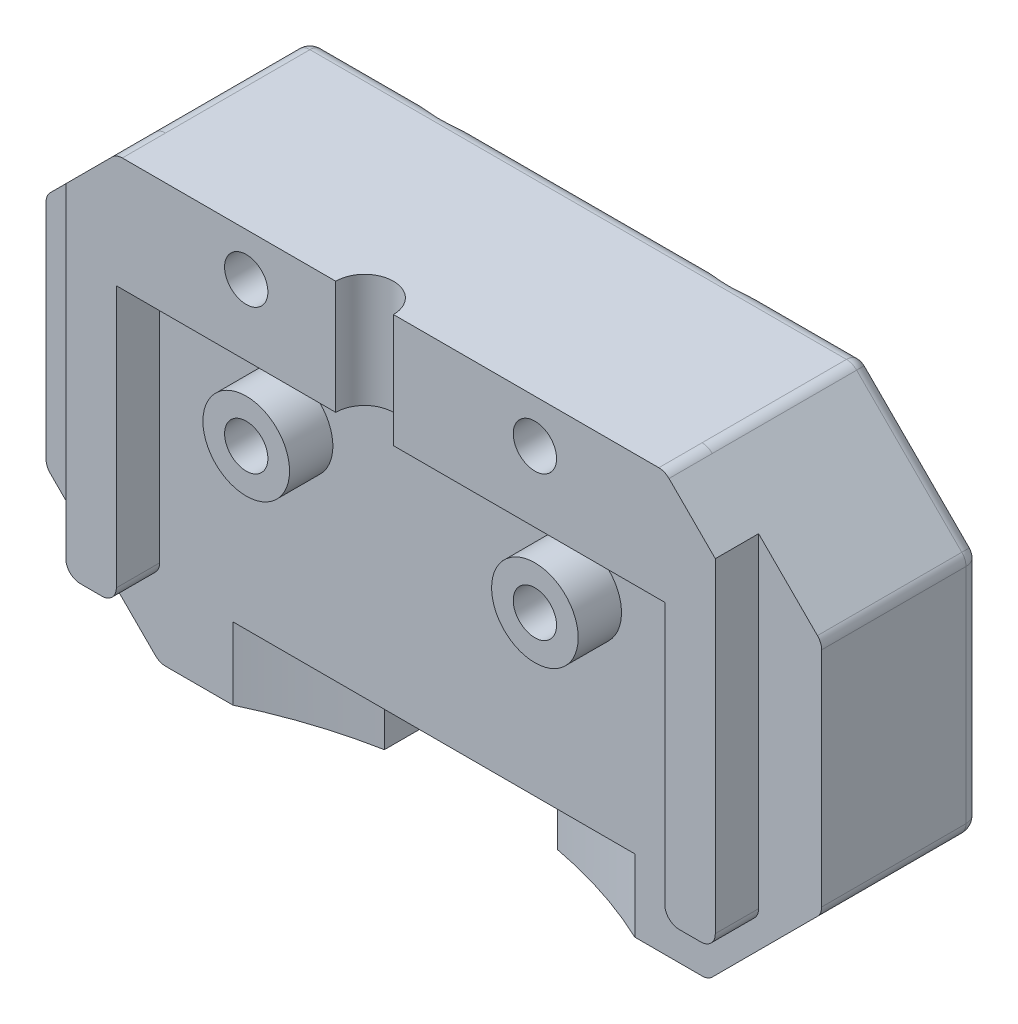
from build123d import *

# Parameters (mm, degrees)
CROQUIS3_W                   = 38
CROQUIS3_H                   = 38
SALIENTE_EXTRUIR9_DEPTH      = 1
SALIENTE_EXTRUIR10_START     = -11
SALIENTE_EXTRUIR10_OUTLINE_W = 38
SALIENTE_EXTRUIR10_OUTLINE_H = 38
SALIENTE_EXTRUIR10_DEPTH     = 10
CROQUIS13_W                  = 38
CROQUIS13_H                  = 38
SALIENTE_EXTRUIR15_DEPTH     = 3
CROQUIS14_R                  = 1.5
CORTAR_EXTRUIR1_DEPTH        = 14
CROQUIS15_W                  = 38
CROQUIS15_H                  = 24.129942315
CROQUIS15_R                  = 3.5
SALIENTE_EXTRUIR16_DEPTH     = 1
CORTAR_EXTRUIR2_DEPTH        = 14
SALIENTE_EXTRUIR17_DEPTH     = 5
SALIENTE_EXTRUIR18_DEPTH     = 5
CORTAR_EXTRUIR3_DEPTH        = 3
REDONDEO11_R                 = 1
CROQUIS21_R                  = 1.5
CORTAR_EXTRUIR4_DEPTH        = 11
SALIENTE_EXTRUIR20_START     = 3
CROQUIS22_R                  = 3
CROQUIS22_R_2                = 1.5
SALIENTE_EXTRUIR20_DEPTH     = 3
CHAFL_N1_SIZE                = 2
REDONDEO12_R                 = 1
CORTAR_EXTRUIR5_DEPTH        = 5
REDONDEO13_R                 = 1


# Read off the part's stored shape, not the designer's step: Saliente-Extruir10
with BuildPart() as part:
    # Croquis3 → Saliente-Extruir9 (new body)
    with BuildSketch(Plane.XY.offset(5)):
        Polygon((19, -5.370057685), (26.870057685, 2.5), (26.870057685, 40.5), (19, 48.370057685), (-19, 48.370057685), (-26.870057685, 40.5), (-26.870057685, 2.5), (-19, -5.370057685), align=None)
        with Locations((0, 21.5)):
            Rectangle(CROQUIS3_W, CROQUIS3_H, mode=Mode.SUBTRACT)
    extrude(amount=-SALIENTE_EXTRUIR9_DEPTH)

    # Saliente-Extruir10 outline → Saliente-Extruir10 (add)
    with BuildSketch(Plane(origin=(0, 0, 4), x_dir=(-1, 0, 0), z_dir=(0, 0, -1)).offset(SALIENTE_EXTRUIR10_START)):
        Polygon((-26.870057685, 2.5), (-19, -5.370057685), (19, -5.370057685), (26.870057685, 2.5), (26.870057685, 40.5), (19, 48.370057685), (-19, 48.370057685), (-26.870057685, 40.5), align=None)
        with Locations((0, 21.5)):
            Rectangle(SALIENTE_EXTRUIR10_OUTLINE_W, SALIENTE_EXTRUIR10_OUTLINE_H, mode=Mode.SUBTRACT)
    extrude(amount=SALIENTE_EXTRUIR10_DEPTH)

    # Croquis13 → Saliente-Extruir15 (add)
    with BuildSketch(Plane.XY.offset(15)):
        with BuildLine():
            Line((-22.5, 44.870057685), (-22.5, -1))
            Line((-22.5, -1), (22.5, -1))
            Line((22.5, -1), (22.5, 44.870057685))
            Line((22.5, 44.870057685), (19.292893219, 48.077164466))
            ThreePointArc((19.292893219, 48.077164466), (18.96846987, 48.293937218), (18.585786438, 48.370057685))
            Line((18.585786438, 48.370057685), (-18.585786438, 48.370057685))
            ThreePointArc((-18.585786438, 48.370057685), (-18.96846987, 48.293937218), (-19.292893219, 48.077164466))
            Line((-19.292893219, 48.077164466), (-22.5, 44.870057685))
        make_face()
        with Locations((0, 21.5)):
            Rectangle(CROQUIS13_W, CROQUIS13_H, mode=Mode.SUBTRACT)
    extrude(amount=SALIENTE_EXTRUIR15_DEPTH)

    # Croquis14 → Cortar-Extruir1 (cut)
    with BuildSketch(Plane(origin=(0, 0, 4), x_dir=(-1, 0, 0), z_dir=(0, 0, -1))):
        with Locations((10, 45.37415474)):
            Circle(CROQUIS14_R)
        with Locations(Location((-10, 45.37415474, 0), (0, 0, 180))):
            Circle(CROQUIS14_R)
    extrude(amount=-CORTAR_EXTRUIR1_DEPTH, mode=Mode.SUBTRACT)

    # Croquis15 → Saliente-Extruir16 (add)
    with BuildSketch(Plane(origin=(0, 0, 4), x_dir=(-1, 0, 0), z_dir=(0, 0, -1))):
        with Locations((0, 28.435028843)):
            Rectangle(CROQUIS15_W, CROQUIS15_H)
        with Locations((0, 25.370057685)):
            Circle(CROQUIS15_R, mode=Mode.SUBTRACT)
    extrude(amount=-SALIENTE_EXTRUIR16_DEPTH)

    # Croquis16 → Cortar-Extruir2 (cut)
    with BuildSketch(Plane(origin=(0, 0, 4), x_dir=(-1, 0, 0), z_dir=(0, 0, -1))):
        Polygon((-19, 2.5), (-19, 16.370057685), (-26.870057685, 24.24011537), (-26.870057685, 2.5), (-19, -5.370057685), (19, -5.370057685), (26.870057685, 2.5), (26.870057685, 24.24011537), (19, 16.370057685), (19, 2.5), align=None)
    extrude(amount=-CORTAR_EXTRUIR2_DEPTH, mode=Mode.SUBTRACT)

    # Croquis17 → Saliente-Extruir17 (add)
    with BuildSketch(Plane.XY.offset(5)):
        Polygon((6, 31.370057685), (6, 25.370057685), (6, 19.370057685), (6, 16.370057685), (19, 16.370057685), (19, 40.5), (-19, 40.5), (-19, 16.370057685), (-6, 16.370057685), (-6, 19.370057685), (-6, 31.370057685), align=None)
    extrude(amount=SALIENTE_EXTRUIR17_DEPTH)

    # Croquis18 → Saliente-Extruir18 (add)
    with BuildSketch(Plane.XY.offset(10)):
        Polygon((-19, 40.5), (-19, 16.370057685), (-6, 16.370057685), (-6, 19.370057685), (6, 19.370057685), (6, 16.370057685), (19, 16.370057685), (19, 40.5), align=None)
    extrude(amount=SALIENTE_EXTRUIR18_DEPTH)

    # Croquis19 → Cortar-Extruir3 (cut)
    with BuildSketch(Plane.XY.offset(18)):
        Polygon((-22.5, 19.870057685), (-19, 16.370057685), (-19, 21.370057685), (-22.5, 21.370057685), align=None)
        Polygon((19, 16.370057685), (22.5, 19.870057685), (22.5, 21.370057685), (19, 21.370057685), align=None)
    extrude(amount=-CORTAR_EXTRUIR3_DEPTH, mode=Mode.SUBTRACT)

    # Redondeo11
    redondeo11_edges = [part.edges().sort_by_distance(p)[0] for p in [
        (26.870057685, 40.5, 10),
        (19, 48.370057685, 10),
        (-19, 48.370057685, 10),
        (-26.870057685, 40.5, 10),
        (26.870057685, 24.24011537, 9.5),
        (19, 16.370057685, 9.5),
        (-26.870057685, 24.24011537, 9.5),
        (-19, 16.370057685, 9.5),
    ]]
    fillet(redondeo11_edges, radius=REDONDEO11_R)

    # Croquis21 → Cortar-Extruir4 (cut)
    with BuildSketch(Plane.XY.offset(15)):
        with Locations((-10, 35.37415474)):
            Circle(CROQUIS21_R)
        with Locations((10, 35.37415474)):
            Circle(CROQUIS21_R)
    extrude(amount=-CORTAR_EXTRUIR4_DEPTH, mode=Mode.SUBTRACT)

    # Croquis22 → Saliente-Extruir20 (add)
    # profile 1 of 2: a face of its own
    with BuildSketch(Plane.XY.offset(15).offset(SALIENTE_EXTRUIR20_START)):
        with Locations(Location((-10, 35.37415474, 0), (0, 0, 180))):
            Circle(CROQUIS22_R)
        with Locations((-10, 35.37415474)):
            Circle(CROQUIS22_R_2, mode=Mode.SUBTRACT)
    # profile 2 of 2: a face of its own
    with BuildSketch(Plane.XY.offset(15).offset(SALIENTE_EXTRUIR20_START)):
        with Locations(Location((10, 35.37415474, 0), (0, 0, 180))):
            Circle(CROQUIS22_R)
        with Locations((10, 35.37415474)):
            Circle(CROQUIS22_R_2, mode=Mode.SUBTRACT)
    extrude(amount=-SALIENTE_EXTRUIR20_DEPTH)

    # Croquis23 → Cortar-Revolución1 (revolve, cut)
    with BuildSketch(Plane.XY.offset(18)):
        Polygon((-1.8, 48.370057685), (-1.8, 44.97415474), (-1.8, 40.5), (0.2, 40.5), (0.2, 48.370057685), align=None)
    revolve(axis=Axis((-1.8, 44.97415474, 18), (0, 1, 0)), mode=Mode.SUBTRACT)

    # Chaflán1
    # the kernel refuses this chamfer: 2 mm, written as the material it takes off along each edge
    with BuildSketch(Plane(origin=(-10, 45.37415474, 4), x_dir=(-1, 0, 0), z_dir=(0, -1, 0))) as chafl_n1_piece_1:
        Polygon((1.5 + CHAFL_N1_SIZE, 0), (1.5, -CHAFL_N1_SIZE), (1.5, 0), align=None)
    revolve(axis=Axis((-10, 45.37415474, 4), (0, 0, -1)), mode=Mode.SUBTRACT)
    with BuildSketch(Plane(origin=(10, 45.37415474, 4), x_dir=(1, 0, 0), z_dir=(0, 1, 0))) as chafl_n1_piece_2:
        Polygon((1.5 + CHAFL_N1_SIZE, 0), (1.5, -CHAFL_N1_SIZE), (1.5, 0), align=None)
    revolve(axis=Axis((10, 45.37415474, 4), (0, 0, -1)), mode=Mode.SUBTRACT)
    with BuildSketch(Plane(origin=(-10, 35.37415474, 4), x_dir=(1, 0, 0), z_dir=(0, -1, 0))) as chafl_n1_piece_3:
        Polygon((1.5 + CHAFL_N1_SIZE, 0), (1.5, CHAFL_N1_SIZE), (1.5, 0), align=None)
    revolve(axis=Axis((-10, 35.37415474, 4), (0, 0, 1)), mode=Mode.SUBTRACT)
    with BuildSketch(Plane(origin=(10, 35.37415474, 4), x_dir=(1, 0, 0), z_dir=(0, -1, 0))) as chafl_n1_piece_4:
        Polygon((1.5 + CHAFL_N1_SIZE, 0), (1.5, CHAFL_N1_SIZE), (1.5, 0), align=None)
    revolve(axis=Axis((10, 35.37415474, 4), (0, 0, 1)), mode=Mode.SUBTRACT)

    # Redondeo12
    # the kernel refuses this fillet: 1 mm, written as the material it takes off along each edge
    with BuildSketch(Plane(origin=(26.870057685, 24.654328933, 4), x_dir=(-1, 0, 0), z_dir=(0, 1, 0)), Plane(origin=(-26.870057685, 40.085786438, 4), x_dir=(1, 0, 0), z_dir=(0, -1, 0))) as redondeo12_piece_1:
        with BuildLine():
            CenterArc((REDONDEO12_R, REDONDEO12_R), REDONDEO12_R, 180, 90)
            Line((0, REDONDEO12_R), (0, 0))
            Line((0, 0), (REDONDEO12_R, 0))
        make_face()
    extrude(amount=15.431457505, mode=Mode.SUBTRACT)
    with BuildSketch(Plane(origin=(26.577164466, 40.792893219, 4), x_dir=(-0.7071067811865461, -0.707106781186549, 0), z_dir=(-0.707106781186549, 0.7071067811865461, 0)), Plane(origin=(-26.577164466, 23.947222151, 4), x_dir=(0.7071067811865487, 0.7071067811865465, 0), z_dir=(0.7071067811865465, -0.7071067811865487, 0)), Plane(origin=(-19.292893219, 48.077164466, 4), x_dir=(0.7071067811865487, -0.7071067811865465, 0), z_dir=(-0.7071067811865465, -0.7071067811865487, 0)), Plane(origin=(19.292893219, 16.662950904, 4), x_dir=(-0.7071067811865485, 0.7071067811865467, 0), z_dir=(0.7071067811865466, 0.7071067811865485, 0))) as redondeo12_piece_2:
        with BuildLine():
            CenterArc((REDONDEO12_R, REDONDEO12_R), REDONDEO12_R, 180, 90)
            Line((0, REDONDEO12_R), (0, 0))
            Line((0, 0), (REDONDEO12_R, 0))
        make_face()
    extrude(amount=10.30151519, mode=Mode.SUBTRACT)
    with BuildSketch(Plane(origin=(18.585786438, 48.370057685, 4), x_dir=(0, -1, 0), z_dir=(-1, 0, 0)), Plane(origin=(-9.309576067, 48.370057685, 4), x_dir=(0, -1, 0), z_dir=(-1, 0, 0))) as redondeo12_piece_3:
        with BuildLine():
            CenterArc((REDONDEO12_R, REDONDEO12_R), REDONDEO12_R, 180, 90)
            Line((0, REDONDEO12_R), (0, 0))
            Line((0, 0), (REDONDEO12_R, 0))
        make_face()
    extrude(amount=9.276210371, mode=Mode.SUBTRACT)
    with BuildSketch(Plane(origin=(18.585786438, 16.370057685, 4), x_dir=(0, 1, 0), z_dir=(-1, 0, 0))) as redondeo12_piece_4:
        with BuildLine():
            CenterArc((REDONDEO12_R, -REDONDEO12_R), REDONDEO12_R, 90, 90)
            Line((0, -REDONDEO12_R), (0, 0))
            Line((0, 0), (REDONDEO12_R, 0))
        make_face()
    extrude(amount=37.171572875, mode=Mode.SUBTRACT)
    with BuildSketch(Plane(origin=(-18.585786438, 17.370057685, 4), x_dir=(-0.7071067811865493, -0.7071067811865458, 0), z_dir=(-0.7071067811865458, 0.7071067811865493, 0))) as redondeo12_piece_5:
        with BuildLine():
            CenterArc((1 - REDONDEO12_R, REDONDEO12_R), REDONDEO12_R, 270, 90)
            Line((1, REDONDEO12_R), (1, 0))
            Line((1, 0), (1 - REDONDEO12_R, 0))
        make_face()
    revolve(axis=Axis((-18.585786438, 17.370057685, 4), (0, 0, 1)), revolution_arc=45, mode=Mode.SUBTRACT)
    with BuildSketch(Plane(origin=(-25.870057685, 24.654328933, 4), x_dir=(-1, 0, 0), z_dir=(0, 1, 0))) as redondeo12_piece_6:
        with BuildLine():
            CenterArc((1 - REDONDEO12_R, REDONDEO12_R), REDONDEO12_R, 270, 90)
            Line((1, REDONDEO12_R), (1, 0))
            Line((1, 0), (1 - REDONDEO12_R, 0))
        make_face()
    revolve(axis=Axis((-25.870057685, 24.654328933, 4), (0, 0, 1)), revolution_arc=45, mode=Mode.SUBTRACT)
    with BuildSketch(Plane(origin=(18.585786438, 17.370057685, 4), x_dir=(0, -1, 0), z_dir=(-1, 0, 0))) as redondeo12_piece_7:
        with BuildLine():
            CenterArc((1 - REDONDEO12_R, REDONDEO12_R), REDONDEO12_R, 270, 90)
            Line((1, REDONDEO12_R), (1, 0))
            Line((1, 0), (1 - REDONDEO12_R, 0))
        make_face()
    revolve(axis=Axis((18.585786438, 17.370057685, 4), (0, 0, 1)), revolution_arc=45, mode=Mode.SUBTRACT)
    with BuildSketch(Plane(origin=(25.870057685, 24.654328933, 4), x_dir=(1, 0, 0), z_dir=(0, 1, 0))) as redondeo12_piece_8:
        with BuildLine():
            CenterArc((1 - REDONDEO12_R, -REDONDEO12_R), REDONDEO12_R, 0, 90)
            Line((1, -REDONDEO12_R), (1, 0))
            Line((1, 0), (1 - REDONDEO12_R, 0))
        make_face()
    revolve(axis=Axis((25.870057685, 24.654328933, 4), (0, 0, -1)), revolution_arc=45, mode=Mode.SUBTRACT)
    with BuildSketch(Plane(origin=(-25.870057685, 40.085786438, 4), x_dir=(-0.7071067811865493, 0.7071067811865458, 0), z_dir=(0.7071067811865458, 0.7071067811865493, 0))) as redondeo12_piece_9:
        with BuildLine():
            CenterArc((1 - REDONDEO12_R, REDONDEO12_R), REDONDEO12_R, 270, 90)
            Line((1, REDONDEO12_R), (1, 0))
            Line((1, 0), (1 - REDONDEO12_R, 0))
        make_face()
    revolve(axis=Axis((-25.870057685, 40.085786438, 4), (0, 0, 1)), revolution_arc=45, mode=Mode.SUBTRACT)
    with BuildSketch(Plane(origin=(-18.585786438, 47.370057685, 4), x_dir=(0, 1, 0), z_dir=(1, 0, 0))) as redondeo12_piece_10:
        with BuildLine():
            CenterArc((1 - REDONDEO12_R, REDONDEO12_R), REDONDEO12_R, 270, 90)
            Line((1, REDONDEO12_R), (1, 0))
            Line((1, 0), (1 - REDONDEO12_R, 0))
        make_face()
    revolve(axis=Axis((-18.585786438, 47.370057685, 4), (0, 0, 1)), revolution_arc=45, mode=Mode.SUBTRACT)
    with BuildSketch(Plane(origin=(18.585786438, 47.370057685, 4), x_dir=(0.7071067811865476, 0.7071067811865476, 0), z_dir=(0.7071067811865476, -0.7071067811865476, 0))) as redondeo12_piece_11:
        with BuildLine():
            CenterArc((1 - REDONDEO12_R, REDONDEO12_R), REDONDEO12_R, 270, 90)
            Line((1, REDONDEO12_R), (1, 0))
            Line((1, 0), (1 - REDONDEO12_R, 0))
        make_face()
    revolve(axis=Axis((18.585786438, 47.370057685, 4), (0, 0, 1)), revolution_arc=45, mode=Mode.SUBTRACT)
    with BuildSketch(Plane(origin=(25.870057685, 40.085786438, 4), x_dir=(1, 0, 0), z_dir=(0, -1, 0))) as redondeo12_piece_12:
        with BuildLine():
            CenterArc((1 - REDONDEO12_R, REDONDEO12_R), REDONDEO12_R, 270, 90)
            Line((1, REDONDEO12_R), (1, 0))
            Line((1, 0), (1 - REDONDEO12_R, 0))
        make_face()
    revolve(axis=Axis((25.870057685, 40.085786438, 4), (0, 0, 1)), revolution_arc=45, mode=Mode.SUBTRACT)
    with BuildSketch(Plane(origin=(10.690423933, 48.370057685, 4), x_dir=(0, -1, 0), z_dir=(-1, 0, 0))) as redondeo12_piece_13:
        with BuildLine():
            CenterArc((REDONDEO12_R, REDONDEO12_R), REDONDEO12_R, 180, 90)
            Line((0, REDONDEO12_R), (0, 0))
            Line((0, 0), (REDONDEO12_R, 0))
        make_face()
    extrude(amount=21.380847867, mode=Mode.SUBTRACT)

    # Croquis24 → Cortar-Extruir5 (cut)
    with BuildSketch(Plane.XZ.offset(-21.370057685)):
        with BuildLine():
            Line((-19, 18), (19, 18))
            ThreePointArc((19, 18), (0, 11.867593747), (-19, 18))
        make_face()
    extrude(amount=CORTAR_EXTRUIR5_DEPTH, mode=Mode.SUBTRACT)

    # Redondeo13
    redondeo13_edges = [part.edges().sort_by_distance(p)[0] for p in [
        (22.5, 21.370057685, 16.5),
        (19, 21.370057685, 16.5),
        (-19, 21.370057685, 16.5),
        (-22.5, 21.370057685, 16.5),
    ]]
    fillet(redondeo13_edges, radius=REDONDEO13_R)


solid = part.part
